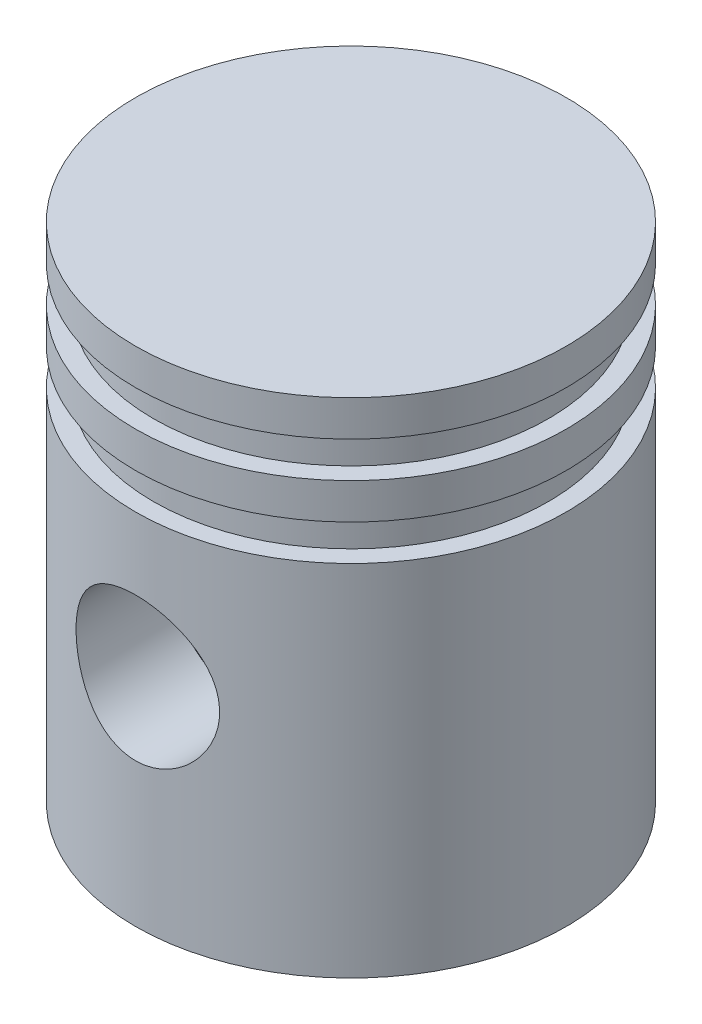
from build123d import *

# Parameters (mm, degrees)
SKETCH1_R           = 15
BOSS_EXTRUDE1_DEPTH = 35
SKETCH2_W           = 1.25
SKETCH2_H           = 2.5
SKETCH4_R           = 5
CUT_EXTRUDE1_DEPTH  = 15
SKETCH5_R           = 10.25
CUT_EXTRUDE2_DEPTH  = 25
SKETCH6_R           = 6.5
SKETCH6_R_2         = 5
BOSS_EXTRUDE2_DEPTH = 12.5
SKETCH9_W           = 15
SKETCH9_H           = 15
CUT_EXTRUDE4_DEPTH  = 13


with BuildPart() as part:
    # Sketch1 → Boss-Extrude1 (new body)
    with BuildSketch(Plane(origin=(0, 0, 0), x_dir=(1, 0, 0), z_dir=(0, 1, 0))):
        with Locations(Location((0, 0, 0), (0, 0, 270))):
            Circle(SKETCH1_R)
    extrude(amount=-BOSS_EXTRUDE1_DEPTH)

    # Sketch2 → Cut-Revolve3 (revolve, cut)
    with BuildSketch(Plane.XY, mode=Mode.PRIVATE) as cut_revolve3_sk:
        with Locations((-14.375, -3.75)):
            Rectangle(SKETCH2_W, SKETCH2_H)
        with Locations((-14.375, -8.75)):
            Rectangle(SKETCH2_W, SKETCH2_H)
    revolve(cut_revolve3_sk.sketch.rotate(Axis((0, 0, 0), (0, 1, 0)), 90), axis=Axis((0, 0, 0), (0, 1, 0)), mode=Mode.SUBTRACT)

    # Sketch4 → Cut-Extrude1 (cut, symmetric)
    with BuildSketch(Plane.XY):
        with Locations(Location((0, -20, 0), (0, 0, 90))):
            Circle(SKETCH4_R)
    extrude(amount=CUT_EXTRUDE1_DEPTH, both=True, mode=Mode.SUBTRACT)

    # Sketch5 → Cut-Extrude2 (cut)
    with BuildSketch(Plane(origin=(0, -35, 0), x_dir=(-1, 0, 0), z_dir=(0, -1, 0))):
        with Locations(Location((0, 0, 0), (0, 0, 90))):
            Circle(SKETCH5_R)
    extrude(amount=-CUT_EXTRUDE2_DEPTH, mode=Mode.SUBTRACT)

    # Sketch6 → Boss-Extrude2 (add, symmetric)
    with BuildSketch(Plane.XY):
        with Locations(Location((0, -20, 0), (0, 0, 180))):
            Circle(SKETCH6_R)
        with Locations(Location((0, -20, 0), (0, 0, 90))):
            Circle(SKETCH6_R_2, mode=Mode.SUBTRACT)
    extrude(amount=BOSS_EXTRUDE2_DEPTH, both=True)

    # Sketch9 → Cut-Extrude4 (cut)
    with BuildSketch(Plane(origin=(6.5, 0, 0), x_dir=(0, 0, -1), z_dir=(1, 0, 0))):
        with Locations((0, -20.153875376)):
            Rectangle(SKETCH9_W, SKETCH9_H)
    extrude(amount=-CUT_EXTRUDE4_DEPTH, mode=Mode.SUBTRACT)


solid = part.part
